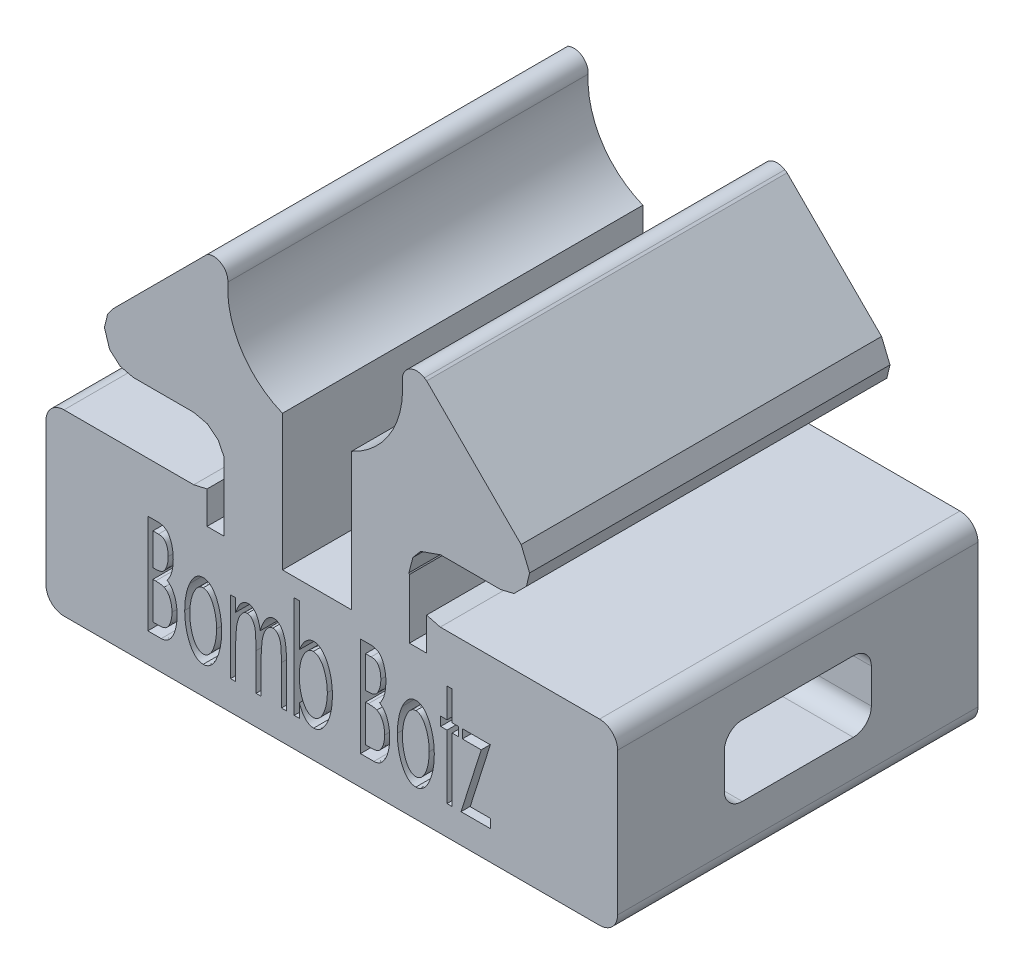
from build123d import *

# Parameters (mm, degrees)
BOSS_EXTRUDE1_DEPTH = 12.7
SKETCH10_R          = 3.082136138
CUT_EXTRUDE1_DEPTH  = 26.185474767
SKETCH11_W          = 2.435876878
SKETCH11_H          = 7.908405343
CUT_EXTRUDE2_DEPTH  = 26.185474767
SKETCH13_W          = 5.182015338
SKETCH13_H          = 2.489456313
CUT_EXTRUDE4_DEPTH  = 31.460304214
FILLET1_R           = 0.635
FILLET2_R           = 0.635
FILLET3_R           = 0.508
CUT_EXTRUDE5_DEPTH  = 1.27
SKETCH17_W          = 0.605016918
SKETCH17_H          = 2.095446093
SKETCH17_W_2        = 0.604461085
SKETCH17_H_2        = 2.141007526
CUT_EXTRUDE7_DEPTH  = 26.185474884


with BuildPart() as part:
    # Sketch5 → Boss-Extrude1 (new body)
    with BuildSketch(Plane.XY):
        Polygon((-6.474794456, -10.4902), (-6.938297275, -10.378313453), (-7.308763147, -10.05450356), (-7.490794456, -9.4742), (-7.378907909, -9.01069718), (-7.193214945, -8.75577951), (-3.863171405, -5.42573597), (-2.833127272, -4.737482484), (-1.618107374, -4.4958), (1.618107374, -4.4958), (2.668236067, -4.674493152), (3.863171405, -5.42573597), (7.193214945, -8.75577951), (7.490794456, -9.4742), (7.378907909, -9.93770282), (6.938297275, -10.378313453), (6.474794456, -10.4902), (4.3434, -10.4902), (3.646537163, -10.737670005), (3.377082754, -11.059343535), (3.2385, -11.5951), (3.485970005, -12.291962837), (3.807643535, -12.561417246), (4.3434, -12.7), (10.5918, -12.7), (10.5918, -18.995576116), (-9.5504, -18.995576116), (-9.5504, -12.7), (-4.3434, -12.7), (-3.863171405, -12.590180165), (-3.485969976, -12.291962837), (-3.271081829, -11.861441531), (-3.271081829, -11.328758469), (-3.485969976, -10.898237163), (-3.863171405, -10.600019835), (-4.3434, -10.4902), align=None)
    extrude(amount=-BOSS_EXTRUDE1_DEPTH)

    # Sketch10 → Cut-Extrude1 (cut, through all)
    with BuildSketch(Plane.XY):
        with Locations((-0.066530556, -6.095976424)):
            Circle(SKETCH10_R)
    extrude(amount=-CUT_EXTRUDE1_DEPTH, mode=Mode.SUBTRACT)

    # Sketch11 → Cut-Extrude2 (cut, through all)
    with BuildSketch(Plane.XY):
        with Locations((0, -9.781904855)):
            Rectangle(SKETCH11_W, SKETCH11_H)
    extrude(amount=-CUT_EXTRUDE2_DEPTH, mode=Mode.SUBTRACT)

    # Sketch13 → Cut-Extrude4 (cut, through all)
    with BuildSketch(Plane.ZY.offset(9.5504)):
        with Locations((-6.35, -15.847788058)):
            Rectangle(SKETCH13_W, SKETCH13_H)
    extrude(amount=-CUT_EXTRUDE4_DEPTH, mode=Mode.SUBTRACT)

    # Fillet1
    fillet1_edges = [part.edges().sort_by_distance(p)[0] for p in [
        (-9.5504, -12.7, -6.35),
    ]]
    fillet(fillet1_edges, radius=FILLET1_R)

    # Fillet2
    fillet2_edges = [part.edges().sort_by_distance(p)[0] for p in [
        (0.5207, -14.603059901, -3.758992331),
        (0.5207, -17.092516214, -3.758992331),
        (0.5207, -17.092516214, -8.941007669),
        (0.5207, -14.603059901, -8.941007669),
        (10.5918, -12.7, -6.35),
        (10.5918, -18.995576116, -6.35),
        (-9.5504, -18.995576116, -6.35),
    ]]
    fillet(fillet2_edges, radius=FILLET2_R)

    # Fillet3
    # the kernel refuses this fillet: 0.508 mm, written as the material it takes off along each edge
    with BuildSketch(Plane(origin=(2.668236067, -4.674493152, 3.28944818), x_dir=(0.8465916632907232, -0.5322429479538895, 0), z_dir=(0, 0, -1))) as fillet3_piece_1:
        with BuildLine():
            CenterArc((1.315779272, 0.508), FILLET3_R, 143.192029884, 126.807970116)
            Line((0.90905007, 0.812360569), (0.900915486, 0.81844778))
            ThreePointArc((0.900915486, 0.81844778), (0.488321858, 0.368360866), (-0.005137978, 0.008765089))
            Line((-0.005137978, 0.008765089), (0, -0.01016))
            Line((0, -0.01016), (1.315779272, -0.01016))
            Line((1.315779272, -0.01016), (1.315779272, 0))
        make_face()
    extrude(amount=19.278896361, mode=Mode.SUBTRACT)
    with BuildSketch(Plane(origin=(-2.833127272, -4.737482484, 3.097058862), x_dir=(-0.8314696122997464, -0.5555702330237908, 0), z_dir=(0, 0, -1))) as fillet3_piece_2:
        with BuildLine():
            CenterArc((1.31839441, -0.501729486), FILLET3_R, 99.011665767, 118.073467257)
            Line((0.913142276, -0.808054001), (0.905037233, -0.814180491))
            ThreePointArc((0.905037233, -0.814180491), (0.490196501, -0.366028623), (-0.005094947, -0.008790172))
            Line((-0.005094947, -0.008790172), (0, 0.01016))
            ThreePointArc((0, 0.01016), (0.619411772, 0.01016), (1.237232128, 0.01003459))
            Line((1.237232128, 0.01003459), (1.238823545, 0))
        make_face()
    extrude(amount=18.894117724, mode=Mode.SUBTRACT)

    # Sketch15 → Cut-Extrude5 (cut)
    # profile 1 of 8: a face of its own
    with BuildSketch(Plane.XY):
        with BuildLine():
            Line((-5.963589534, -14.467780526), (-5.62214322, -14.467780526))
            add(Edge.make_bspline(
                [(-5.62214322, -14.467780526), (-5.589534178, -14.46878798), (-5.527901506, -14.470692118), (-5.441516013, -14.490243243), (-5.365936065, -14.520174515), (-5.302987249, -14.566695465), (-5.249771139, -14.625144193), (-5.202864844, -14.696129356), (-5.163082389, -14.780723785), (-5.128349989, -14.876964552), (-5.101094391, -14.98243947), (-5.080415702, -15.094850671), (-5.068697057, -15.213056959), (-5.067011592, -15.293910926), (-5.066153636, -15.335068186)],
                knots=[0, 0, 0, 0, 1.007703189, 1.904607924, 2.728231251, 3.505327209, 4.303946819, 5.16473243, 6.128960489, 7.190833427, 8.327918668, 9.497182713, 10.725985794, 12, 12, 12, 12], degree=3))
            add(Edge.make_bspline(
                [(-5.066153636, -15.335068186), (-5.06679237, -15.37365502), (-5.068041356, -15.449108083), (-5.078819113, -15.559683483), (-5.09614865, -15.664916555), (-5.120267823, -15.7642439), (-5.151770234, -15.856240685), (-5.1893233, -15.939825865), (-5.233419851, -16.014982543), (-5.269354712, -16.058354109), (-5.287007002, -16.079659533)],
                knots=[0, 0, 0, 0, 1.167664483, 2.283262239, 3.358923896, 4.393422853, 5.373199395, 6.29755825, 7.163709169, 8, 8, 8, 8], degree=3))
            add(Edge.make_bspline(
                [(-5.287007002, -16.079659533), (-5.265820126, -16.095080339), (-5.224295143, -16.125304178), (-5.169500865, -16.178012614), (-5.121183642, -16.233812414), (-5.081674484, -16.295437248), (-5.048107352, -16.361552921), (-5.017327508, -16.432968522), (-4.992028559, -16.511264668), (-4.970278844, -16.595558431), (-4.953059318, -16.684537391), (-4.940091307, -16.777884919), (-4.933516036, -16.874870461), (-4.932203241, -16.940862846), (-4.931538252, -16.974290943)],
                knots=[0, 0, 0, 0, 0.940213205, 1.842760421, 2.724135194, 3.585617653, 4.464149597, 5.385626676, 6.375777621, 7.416178614, 8.510967562, 9.629286614, 10.799127532, 12, 12, 12, 12], degree=3))
            add(Edge.make_bspline(
                [(-4.931538252, -16.974290943), (-4.931796917, -17.008429669), (-4.932304329, -17.075398123), (-4.940567322, -17.17364715), (-4.952378885, -17.267695274), (-4.968054258, -17.358033369), (-4.990305018, -17.444204206), (-5.01563402, -17.526922141), (-5.046920587, -17.605290821), (-5.082042167, -17.678765991), (-5.121005728, -17.746111774), (-5.163309515, -17.805500706), (-5.210257707, -17.854922704), (-5.259417575, -17.896441948), (-5.312482472, -17.928350746), (-5.368830889, -17.950905706), (-5.428325845, -17.965867284), (-5.469440698, -17.967135904), (-5.490332322, -17.967780526)],
                knots=[0, 0, 0, 0, 1.305706815, 2.561348188, 3.769087172, 4.931904447, 6.066077104, 7.171803036, 8.239419409, 9.29119266, 10.284925843, 11.21314407, 12.073370583, 12.886194184, 13.668239408, 14.430351689, 15.202417108, 16, 16, 16, 16], degree=3))
            Line((-5.490332322, -17.967780526), (-5.963589534, -17.967780526))
            Line((-5.963589534, -17.967780526), (-5.963589534, -14.467780526))
        make_face()
        with BuildLine():
            Line((-5.784102354, -14.826754885), (-5.784102354, -15.948549757))
            Line((-5.784102354, -15.948549757), (-5.686646425, -15.948549757))
            add(Edge.make_bspline(
                [(-5.686646425, -15.948549757), (-5.659024836, -15.947836275), (-5.607419502, -15.946503279), (-5.535531687, -15.934491662), (-5.475447719, -15.912718893), (-5.425307923, -15.882594026), (-5.384948483, -15.841407515), (-5.349161734, -15.792451241), (-5.319359759, -15.732824027), (-5.29311326, -15.665473087), (-5.271485576, -15.590896983), (-5.256477584, -15.511302634), (-5.246952842, -15.42761469), (-5.246085687, -15.370618638), (-5.245640816, -15.341378283)],
                knots=[0, 0, 0, 0, 1.158126998, 2.163725294, 3.041371376, 3.824793678, 4.594170469, 5.443102772, 6.359364395, 7.380511659, 8.472453147, 9.610495495, 10.77412628, 12, 12, 12, 12], degree=3))
            add(Edge.make_bspline(
                [(-5.245640816, -15.341378283), (-5.24643037, -15.303463298), (-5.247929231, -15.231486835), (-5.263088834, -15.129866037), (-5.288825731, -15.041027529), (-5.319010095, -14.976200149), (-5.34839721, -14.931644521), (-5.373618308, -14.903711491), (-5.401732116, -14.880006633), (-5.432539782, -14.859931293), (-5.467482314, -14.845732101), (-5.504641724, -14.834052065), (-5.545054209, -14.827941221), (-5.572813815, -14.827157735), (-5.58708713, -14.826754885)],
                knots=[0, 0, 0, 0, 1.952265271, 3.706111235, 5.27563019, 6.702738451, 7.37059395, 8.018508953, 8.633599442, 9.261517843, 9.903363777, 10.569915718, 11.264685426, 12, 12, 12, 12], degree=3))
            Line((-5.58708713, -14.826754885), (-5.784102354, -14.826754885))
        make_face(mode=Mode.SUBTRACT)
        with BuildLine():
            Line((-5.784102354, -16.307524116), (-5.784102354, -17.608806167))
            Line((-5.784102354, -17.608806167), (-5.574466938, -17.608806167))
            add(Edge.make_bspline(
                [(-5.574466938, -17.608806167), (-5.545407451, -17.608279987), (-5.491098027, -17.607296608), (-5.416043649, -17.593031784), (-5.352619022, -17.571529907), (-5.301002884, -17.538212916), (-5.258588115, -17.495091397), (-5.222477059, -17.442073954), (-5.189088856, -17.380049388), (-5.162193525, -17.308103991), (-5.139049701, -17.23018603), (-5.12321637, -17.147500883), (-5.113116047, -17.061948199), (-5.111728433, -17.003767041), (-5.111025431, -16.974290943)],
                knots=[0, 0, 0, 0, 1.164888785, 2.177066614, 3.05569501, 3.836540044, 4.619468312, 5.468124174, 6.404245127, 7.441045181, 8.545645698, 9.66450176, 10.816775421, 12, 12, 12, 12], degree=3))
            add(Edge.make_bspline(
                [(-5.111025431, -16.974290943), (-5.112049658, -16.937796388), (-5.114039567, -16.866893291), (-5.127041238, -16.764109234), (-5.150280649, -16.668661019), (-5.182292887, -16.581426879), (-5.221313133, -16.50341528), (-5.268708874, -16.438209418), (-5.322335588, -16.384438771), (-5.364892372, -16.360625795), (-5.385865175, -16.348890302)],
                knots=[0, 0, 0, 0, 1.222452466, 2.375030106, 3.46297454, 4.505675201, 5.48249602, 6.37345105, 7.198405334, 8, 8, 8, 8], degree=3))
            add(Edge.make_bspline(
                [(-5.385865175, -16.348890302), (-5.402761888, -16.342238106), (-5.44117002, -16.327116914), (-5.509900884, -16.316718034), (-5.5936596, -16.308808196), (-5.654827904, -16.307976055), (-5.688048668, -16.307524116)],
                knots=[0, 0, 0, 0, 0.708155266, 1.609716739, 2.701827025, 4, 4, 4, 4], degree=3))
            Line((-5.688048668, -16.307524116), (-5.784102354, -16.307524116))
        make_face(mode=Mode.SUBTRACT)
    # profile 2 of 8: a face of its own
    with BuildSketch(Plane.XY):
        with BuildLine():
            add(Edge.make_bspline(
                [(-4.010965335, -15.365216424), (-3.987202577, -15.366280698), (-3.939938498, -15.368397537), (-3.871505784, -15.390184301), (-3.806668863, -15.424042529), (-3.744146766, -15.470102283), (-3.686232268, -15.530740461), (-3.631389386, -15.603917735), (-3.579378926, -15.689950096), (-3.549286287, -15.753339913), (-3.533501393, -15.786590622)],
                knots=[0, 0, 0, 0, 0.843577701, 1.677874383, 2.529941952, 3.44009667, 4.428447994, 5.503311921, 6.690378774, 8, 8, 8, 8], degree=3))
            add(Edge.make_bspline(
                [(-3.533501393, -15.786590622), (-3.519491202, -15.819131254), (-3.491125789, -15.885013897), (-3.456655297, -15.988080509), (-3.427184931, -16.095315949), (-3.402160687, -16.206805054), (-3.384970642, -16.323147295), (-3.370077074, -16.443447004), (-3.362863943, -16.568252573), (-3.361644666, -16.65293694), (-3.361025431, -16.69594559)],
                knots=[0, 0, 0, 0, 0.911590579, 1.845630971, 2.79426017, 3.773633235, 4.784390523, 5.820063118, 6.892875455, 8, 8, 8, 8], degree=3))
            add(Edge.make_bspline(
                [(-3.361025431, -16.69594559), (-3.361572897, -16.739192091), (-3.362651139, -16.824366626), (-3.37090819, -16.950086518), (-3.386174601, -17.071620024), (-3.404944066, -17.189345325), (-3.431700919, -17.30258021), (-3.461713559, -17.412049943), (-3.499500821, -17.516938511), (-3.541458488, -17.616603421), (-3.587318855, -17.708603167), (-3.638080994, -17.788948002), (-3.691023083, -17.857925388), (-3.748369165, -17.914123077), (-3.808887337, -17.958344391), (-3.873066612, -17.989976554), (-3.940946523, -18.008956451), (-3.987476748, -18.0114125), (-4.010965335, -18.012652321)],
                knots=[0, 0, 0, 0, 1.301298947, 2.562924903, 3.788461415, 4.986201962, 6.14793309, 7.287790237, 8.39993342, 9.49971249, 10.540722194, 11.488924044, 12.355509222, 13.151197152, 13.89676473, 14.601269901, 15.293917145, 16, 16, 16, 16], degree=3))
            add(Edge.make_bspline(
                [(-4.010965335, -18.012652321), (-4.034447933, -18.011387838), (-4.081191959, -18.008870782), (-4.149369699, -17.990121666), (-4.213761248, -17.958353131), (-4.274315659, -17.913932457), (-4.332295632, -17.857975775), (-4.386002732, -17.789163365), (-4.436693222, -17.708580269), (-4.482509623, -17.616586344), (-4.524808833, -17.517109534), (-4.561115474, -17.411749669), (-4.592928896, -17.302850789), (-4.617764342, -17.189125104), (-4.638446077, -17.071781546), (-4.652069501, -16.950009813), (-4.660775452, -16.824379546), (-4.661791563, -16.739196442), (-4.662307483, -16.69594559)],
                knots=[0, 0, 0, 0, 0.705440217, 1.4042363, 2.108100269, 2.852989273, 3.652997896, 4.523145192, 5.47048404, 6.510546275, 7.609324387, 8.718120464, 9.858867499, 11.017987859, 12.215813406, 13.439407729, 14.699885423, 16, 16, 16, 16], degree=3))
            add(Edge.make_bspline(
                [(-4.662307483, -16.69594559), (-4.661692969, -16.6531693), (-4.660479734, -16.568716052), (-4.653158423, -16.444164378), (-4.638734442, -16.323982861), (-4.620028849, -16.208371479), (-4.596193049, -16.096905412), (-4.566883832, -15.989878754), (-4.532055218, -15.88693716), (-4.503820373, -15.821242279), (-4.489831521, -15.788693988)],
                knots=[0, 0, 0, 0, 1.103600926, 2.178839769, 3.216854868, 4.224898256, 5.199312966, 6.155900535, 7.086347569, 8, 8, 8, 8], degree=3))
            add(Edge.make_bspline(
                [(-4.489831521, -15.788693988), (-4.474076444, -15.755193626), (-4.444121502, -15.691499782), (-4.391770495, -15.605051551), (-4.336662092, -15.531607251), (-4.278278402, -15.47116933), (-4.216700031, -15.423544314), (-4.151036233, -15.390265385), (-4.082220383, -15.368444874), (-4.034729354, -15.366293133), (-4.010965335, -15.365216424)],
                knots=[0, 0, 0, 0, 1.3116991, 2.493918051, 3.576000503, 4.560315464, 5.46508553, 6.321043193, 7.159867415, 8, 8, 8, 8], degree=3))
        make_face()
        with BuildLine():
            add(Edge.make_bspline(
                [(-4.011666457, -15.679318988), (-4.02766861, -15.680288622), (-4.059590517, -15.682222898), (-4.106161569, -15.69726926), (-4.150823162, -15.720629207), (-4.193456831, -15.754082854), (-4.234744119, -15.796042499), (-4.273132084, -15.848242325), (-4.310400991, -15.908977592), (-4.345516199, -15.978164139), (-4.377205156, -16.054295668), (-4.406154237, -16.134615747), (-4.429970545, -16.218969048), (-4.448660164, -16.307367435), (-4.464095488, -16.399508548), (-4.475388436, -16.495655751), (-4.481626503, -16.595600463), (-4.482417154, -16.663451854), (-4.482820303, -16.698048956)],
                knots=[0, 0, 0, 0, 0.633328474, 1.263395849, 1.922297409, 2.622747561, 3.402359392, 4.249154536, 5.185072166, 6.225072861, 7.321168891, 8.452296706, 9.607823688, 10.792618436, 12.032427099, 13.310317054, 14.628543482, 16, 16, 16, 16], degree=3))
            add(Edge.make_bspline(
                [(-4.482820303, -16.698048956), (-4.481983217, -16.742714023), (-4.480332326, -16.830801916), (-4.468144573, -16.960540589), (-4.448678688, -17.08563532), (-4.421710713, -17.204465543), (-4.3881774, -17.314706881), (-4.34752978, -17.412579999), (-4.30313266, -17.498328555), (-4.252018464, -17.569291109), (-4.19696323, -17.626499948), (-4.137844282, -17.667210228), (-4.076062094, -17.694418002), (-4.032961036, -17.697183454), (-4.011666457, -17.698549757)],
                knots=[0, 0, 0, 0, 1.343625255, 2.649881141, 3.916827948, 5.150040387, 6.313170605, 7.378672881, 8.334918638, 9.211145051, 10.001680462, 10.70963726, 11.362481287, 12, 12, 12, 12], degree=3))
            add(Edge.make_bspline(
                [(-4.011666457, -17.698549757), (-3.990369901, -17.697185509), (-3.947264841, -17.694424218), (-3.885514088, -17.667183763), (-3.826395718, -17.62670676), (-3.772009812, -17.569044862), (-3.721018335, -17.498165071), (-3.67549436, -17.412945113), (-3.636082439, -17.31450229), (-3.60244675, -17.204401311), (-3.574436639, -17.085734345), (-3.555251226, -16.960527488), (-3.542984135, -16.830805344), (-3.541344161, -16.742715176), (-3.540512611, -16.698048956)],
                knots=[0, 0, 0, 0, 0.63766136, 1.290651464, 1.99876667, 2.784553339, 3.660975812, 4.620765142, 5.683833951, 6.847224424, 8.082295646, 9.349525938, 10.656074103, 12, 12, 12, 12], degree=3))
            add(Edge.make_bspline(
                [(-3.540512611, -16.698048956), (-3.540917405, -16.663452192), (-3.541711282, -16.595601464), (-3.547926106, -16.495651974), (-3.55930322, -16.399522074), (-3.574447572, -16.3072699), (-3.594205809, -16.219039843), (-3.618090984, -16.134784375), (-3.645763882, -16.053971854), (-3.678714058, -15.978336365), (-3.713642118, -15.909008419), (-3.750767855, -15.847948896), (-3.790082493, -15.796526425), (-3.830551542, -15.753837561), (-3.873247933, -15.720664094), (-3.917863454, -15.697259641), (-3.964221929, -15.68230091), (-3.995901747, -15.680309811), (-4.011666457, -15.679318988)],
                knots=[0, 0, 0, 0, 1.372102031, 2.690948916, 3.969440344, 5.209832555, 6.397176509, 7.553247371, 8.681828641, 9.782077646, 10.822567844, 11.758925988, 12.611729478, 13.385237583, 14.08601742, 14.74522911, 15.375593043, 16, 16, 16, 16], degree=3))
        make_face(mode=Mode.SUBTRACT)
    # profile 3 of 8: a face of its own
    with BuildSketch(Plane.XY):
        with BuildLine():
            Line((-3.046922867, -15.410088218), (-2.867435688, -15.410088218))
            Line((-2.867435688, -15.410088218), (-2.867435688, -15.854599436))
            add(Edge.make_bspline(
                [(-2.867435688, -15.854599436), (-2.853298321, -15.816026088), (-2.826740088, -15.743562812), (-2.780775186, -15.645548815), (-2.736282157, -15.562696143), (-2.701775979, -15.516330211), (-2.685845143, -15.494923956)],
                knots=[0, 0, 0, 0, 1.217816216, 2.287770118, 3.209496512, 4, 4, 4, 4], degree=3))
            add(Edge.make_bspline(
                [(-2.685845143, -15.494923956), (-2.664998425, -15.475175166), (-2.625221796, -15.437493441), (-2.557676535, -15.396119877), (-2.487815224, -15.370462583), (-2.440186597, -15.366953252), (-2.416614374, -15.365216424)],
                knots=[0, 0, 0, 0, 1.120991578, 2.138910614, 3.078914958, 4, 4, 4, 4], degree=3))
            add(Edge.make_bspline(
                [(-2.416614374, -15.365216424), (-2.400879607, -15.366305636), (-2.369102749, -15.368505336), (-2.322137155, -15.382041691), (-2.277283011, -15.406274784), (-2.234089026, -15.438666257), (-2.193240891, -15.478357792), (-2.155697853, -15.524380348), (-2.122645874, -15.576692154), (-2.093725851, -15.636395854), (-2.066439025, -15.705113573), (-2.042541969, -15.785933491), (-2.020118981, -15.87982936), (-2.007546153, -15.94708209), (-2.000849149, -15.982904725)],
                knots=[0, 0, 0, 0, 0.70497467, 1.423718626, 2.167988911, 2.97590154, 3.834418343, 4.712110969, 5.629520406, 6.598314936, 7.678802742, 8.936786955, 10.368358232, 12, 12, 12, 12], degree=3))
            add(Edge.make_bspline(
                [(-2.000849149, -15.982904725), (-1.986622637, -15.935220942), (-1.959649447, -15.844813417), (-1.910077395, -15.719927803), (-1.854952378, -15.613259325), (-1.795069115, -15.524564372), (-1.730352825, -15.454687607), (-1.662801731, -15.403380808), (-1.591245647, -15.37115347), (-1.541907864, -15.367166495), (-1.517776233, -15.365216424)],
                knots=[0, 0, 0, 0, 1.430898735, 2.712956173, 3.858598611, 4.878593333, 5.782223817, 6.584917614, 7.307868261, 8, 8, 8, 8], degree=3))
            add(Edge.make_bspline(
                [(-1.517776233, -15.365216424), (-1.495595535, -15.366905958), (-1.451030067, -15.370300571), (-1.386623503, -15.396215434), (-1.328391395, -15.440397528), (-1.274563957, -15.499365455), (-1.225687699, -15.572616424), (-1.183964629, -15.659643461), (-1.149120369, -15.759682058), (-1.125789975, -15.852102452), (-1.110301936, -15.934776278), (-1.099775105, -16.005380488), (-1.091664958, -16.083540889), (-1.084689649, -16.168867434), (-1.079191541, -16.261673774), (-1.074832686, -16.361940096), (-1.072994567, -16.469709887), (-1.072710421, -16.544035558), (-1.072563893, -16.582363859)],
                knots=[0, 0, 0, 0, 0.756463087, 1.519885966, 2.330984414, 3.234758128, 4.235496569, 5.327959897, 6.52219358, 7.848426635, 8.57957358, 9.394668963, 10.285911105, 11.263066096, 12.318715349, 13.461245202, 14.690813573, 16, 16, 16, 16], degree=3))
            Line((-1.072563893, -16.582363859), (-1.072563893, -17.967780526))
            Line((-1.072563893, -17.967780526), (-1.252051072, -17.967780526))
            Line((-1.252051072, -17.967780526), (-1.252051072, -16.580961616))
            add(Edge.make_bspline(
                [(-1.252051072, -16.580961616), (-1.252221688, -16.548241857), (-1.252549529, -16.485370322), (-1.254022878, -16.395157924), (-1.255813841, -16.312867334), (-1.259435853, -16.238781401), (-1.263638477, -16.172636596), (-1.268195165, -16.114363754), (-1.274515396, -16.064104763), (-1.283538316, -16.008642073), (-1.298324189, -15.94791788), (-1.320043218, -15.881734776), (-1.348470382, -15.82330681), (-1.381642423, -15.773267646), (-1.418605965, -15.731380524), (-1.46045825, -15.701396936), (-1.506402975, -15.682163475), (-1.538626384, -15.680274871), (-1.554935688, -15.679318988)],
                knots=[0, 0, 0, 0, 1.51836297, 2.917558436, 4.186860745, 5.337727298, 6.359248196, 7.262593179, 8.049522409, 8.709208536, 9.869236563, 10.946135496, 11.935605254, 12.874073121, 13.726161472, 14.511594637, 15.246670199, 16, 16, 16, 16], degree=3))
            add(Edge.make_bspline(
                [(-1.554935688, -15.679318988), (-1.57511471, -15.680857345), (-1.616325536, -15.683999072), (-1.674632394, -15.713688311), (-1.729758785, -15.758687159), (-1.780379238, -15.820823021), (-1.82706878, -15.896431793), (-1.866921396, -15.98491855), (-1.899129739, -16.085018487), (-1.921729946, -16.176670849), (-1.934944579, -16.259476006), (-1.945074605, -16.332333932), (-1.952344063, -16.415186802), (-1.958389799, -16.507775482), (-1.964389927, -16.610115024), (-1.967446931, -16.722339295), (-1.969661239, -16.844340431), (-1.969884072, -16.928950433), (-1.96999979, -16.972888699)],
                knots=[0, 0, 0, 0, 0.660002353, 1.34789691, 2.107969646, 2.991979148, 3.96914392, 5.025409628, 6.175424129, 7.424845589, 8.126354717, 8.933170354, 9.844345944, 10.861583212, 11.98578703, 13.216546376, 14.554542928, 16, 16, 16, 16], degree=3))
            Line((-1.96999979, -16.972888699), (-1.96999979, -17.967780526))
            Line((-1.96999979, -17.967780526), (-2.14948697, -17.967780526))
            Line((-2.14948697, -17.967780526), (-2.14948697, -16.667199597))
            add(Edge.make_bspline(
                [(-2.14948697, -16.667199597), (-2.149665377, -16.630507108), (-2.150008566, -16.559924117), (-2.151380899, -16.458724822), (-2.153484187, -16.366638964), (-2.156096035, -16.283885796), (-2.159962342, -16.210443031), (-2.16616121, -16.146257419), (-2.170914772, -16.091157584), (-2.180523372, -16.031210124), (-2.193654481, -15.965652027), (-2.21712588, -15.895350445), (-2.244783453, -15.832815175), (-2.278395663, -15.779519837), (-2.315835523, -15.735148391), (-2.358164556, -15.702706269), (-2.404985971, -15.683025047), (-2.437471787, -15.680557335), (-2.453773829, -15.679318988)],
                knots=[0, 0, 0, 0, 1.574861193, 3.029459675, 4.343833698, 5.52814318, 6.583091089, 7.499410718, 8.295893451, 8.955563666, 10.104512628, 11.160794949, 12.130411979, 13.03206512, 13.856786337, 14.609093303, 15.302014803, 16, 16, 16, 16], degree=3))
            add(Edge.make_bspline(
                [(-2.453773829, -15.679318988), (-2.47299374, -15.68096486), (-2.512689613, -15.684364165), (-2.569417632, -15.713092844), (-2.62327393, -15.757186432), (-2.673810878, -15.817473177), (-2.720397506, -15.891454544), (-2.759659107, -15.978668857), (-2.794453143, -16.076732007), (-2.816488361, -16.167410788), (-2.831046134, -16.247960534), (-2.840852402, -16.317188947), (-2.849028046, -16.39413382), (-2.856229779, -16.478737852), (-2.860553372, -16.57112984), (-2.865232888, -16.670896951), (-2.866994243, -16.778671953), (-2.867284892, -16.852996943), (-2.867435688, -16.891558571)],
                knots=[0, 0, 0, 0, 0.667901347, 1.379451074, 2.174339452, 3.088250632, 4.111091931, 5.216854925, 6.419016473, 7.738532864, 8.468087668, 9.275556869, 10.178113764, 11.168435705, 12.23848396, 13.405914129, 14.654124622, 16, 16, 16, 16], degree=3))
            Line((-2.867435688, -16.891558571), (-2.867435688, -17.967780526))
            Line((-2.867435688, -17.967780526), (-3.046922867, -17.967780526))
            Line((-3.046922867, -17.967780526), (-3.046922867, -15.410088218))
        make_face()
    # profile 4 of 8: a face of its own
    with BuildSketch(Plane.XY):
        with BuildLine():
            Line((-0.803333124, -17.967780526), (-0.803333124, -14.378036936))
            Line((-0.803333124, -14.378036936), (-0.623845944, -14.378036936))
            Line((-0.623845944, -14.378036936), (-0.623845944, -15.874230847))
            add(Edge.make_bspline(
                [(-0.623845944, -15.874230847), (-0.606769209, -15.833944157), (-0.574419832, -15.757626916), (-0.517819166, -15.65383745), (-0.459451289, -15.565212242), (-0.396960821, -15.492513369), (-0.330424144, -15.436086241), (-0.26098279, -15.395058873), (-0.187626362, -15.369434782), (-0.137230441, -15.366622746), (-0.112027034, -15.365216424)],
                knots=[0, 0, 0, 0, 1.371279927, 2.597689275, 3.70130467, 4.693297749, 5.593093873, 6.423879366, 7.211769328, 8, 8, 8, 8], degree=3))
            add(Edge.make_bspline(
                [(-0.112027034, -15.365216424), (-0.089695821, -15.366452655), (-0.045216851, -15.368914961), (0.019855829, -15.388284612), (0.082232159, -15.41903263), (0.142460688, -15.461483986), (0.198542247, -15.517523417), (0.252551202, -15.584677097), (0.304572061, -15.663703206), (0.352608216, -15.754131847), (0.3969118, -15.852805107), (0.436560038, -15.957555008), (0.468981155, -16.06785577), (0.496887254, -16.182832765), (0.516432791, -16.303418262), (0.532216053, -16.428709139), (0.541416134, -16.559555882), (0.542346343, -16.64848897), (0.542820723, -16.693842225)],
                knots=[0, 0, 0, 0, 0.666834484, 1.328190814, 2.012624616, 2.739681146, 3.52046551, 4.375006532, 5.313068699, 6.344837697, 7.433265496, 8.545590816, 9.690816455, 10.868811167, 12.080825012, 13.341092928, 14.64403571, 16, 16, 16, 16], degree=3))
            add(Edge.make_bspline(
                [(0.542820723, -16.693842225), (0.542347641, -16.738495444), (0.54141778, -16.826263153), (0.532152526, -16.955461669), (0.516635571, -17.079674044), (0.495929129, -17.199157336), (0.468508823, -17.313354739), (0.435505106, -17.422771353), (0.396513313, -17.527164033), (0.351227078, -17.625203427), (0.302193703, -17.714818996), (0.250482356, -17.794073426), (0.196009944, -17.861174839), (0.138526126, -17.916072263), (0.078856427, -17.959815244), (0.015699071, -17.990441119), (-0.050020484, -18.008690721), (-0.09462314, -18.011331377), (-0.116934886, -18.012652321)],
                knots=[0, 0, 0, 0, 1.340122652, 2.634065311, 3.885240942, 5.096185043, 6.271872362, 7.408055191, 8.524644743, 9.613771782, 10.64668928, 11.58834762, 12.450598855, 13.234564774, 13.968476263, 14.661843387, 15.330609126, 16, 16, 16, 16], degree=3))
            add(Edge.make_bspline(
                [(-0.116934886, -18.012652321), (-0.142340535, -18.011152077), (-0.193280849, -18.008143971), (-0.267609298, -17.983968904), (-0.337067568, -17.943303631), (-0.403675261, -17.888138654), (-0.465373587, -17.815281046), (-0.522732621, -17.724527441), (-0.577337372, -17.616560169), (-0.607779294, -17.536681637), (-0.623845944, -17.494523315)],
                knots=[0, 0, 0, 0, 0.787562838, 1.579125175, 2.397976651, 3.273906639, 4.251222186, 5.347932763, 6.600290935, 8, 8, 8, 8], degree=3))
            Line((-0.623845944, -17.494523315), (-0.623845944, -17.967780526))
            Line((-0.623845944, -17.967780526), (-0.803333124, -17.967780526))
        make_face()
        with BuildLine():
            add(Edge.make_bspline(
                [(-0.130957322, -17.698549757), (-0.108762514, -17.696868232), (-0.063950567, -17.693473185), (0.001011679, -17.667008405), (0.062002828, -17.624293263), (0.119198714, -17.565700803), (0.173305693, -17.493427667), (0.220251736, -17.40628201), (0.262387997, -17.306733517), (0.297942132, -17.195640488), (0.327182508, -17.076177236), (0.347845939, -16.951717085), (0.361032288, -16.823833855), (0.36255928, -16.737578221), (0.363333543, -16.693842225)],
                knots=[0, 0, 0, 0, 0.657786529, 1.328089627, 2.052027622, 2.856990137, 3.749654712, 4.725235723, 5.788901291, 6.956707324, 8.185706879, 9.438700918, 10.701291008, 12, 12, 12, 12], degree=3))
            add(Edge.make_bspline(
                [(0.363333543, -16.693842225), (0.362515262, -16.6501124), (0.360892754, -16.563403749), (0.348237752, -16.434931056), (0.326053949, -16.309764089), (0.297347519, -16.18922513), (0.261550625, -16.076829562), (0.219912862, -15.975740199), (0.171602379, -15.888043707), (0.117775618, -15.814445845), (0.061084807, -15.754171379), (-0.00030003, -15.712198563), (-0.06348854, -15.684265966), (-0.107322823, -15.680948505), (-0.128853957, -15.679318988)],
                knots=[0, 0, 0, 0, 1.292893791, 2.563583935, 3.812134528, 5.049061508, 6.224790131, 7.296423726, 8.277031188, 9.176806139, 9.98799582, 10.708692254, 11.36571745, 12, 12, 12, 12], degree=3))
            add(Edge.make_bspline(
                [(-0.128853957, -15.679318988), (-0.150605532, -15.680974913), (-0.195082482, -15.684360897), (-0.259501399, -15.712090207), (-0.322370505, -15.754448971), (-0.3815601, -15.81397911), (-0.437406001, -15.886280144), (-0.485490032, -15.972034449), (-0.528642743, -16.06819276), (-0.562838674, -16.176082429), (-0.58981971, -16.292663356), (-0.609366557, -16.41683763), (-0.621416857, -16.548004666), (-0.623023281, -16.637959754), (-0.623845944, -16.68402652)],
                knots=[0, 0, 0, 0, 0.642827838, 1.314434586, 2.048503311, 2.881431429, 3.790527276, 4.749602412, 5.788656785, 6.910486039, 8.098690173, 9.333453703, 10.634438985, 12, 12, 12, 12], degree=3))
            add(Edge.make_bspline(
                [(-0.623845944, -16.68402652), (-0.62352508, -16.719329959), (-0.62289543, -16.788607872), (-0.615501691, -16.890359778), (-0.604560639, -16.987720209), (-0.589042526, -17.080612576), (-0.569709236, -17.169240555), (-0.545067439, -17.253231984), (-0.516458906, -17.333046413), (-0.483002563, -17.407130058), (-0.447173655, -17.474919904), (-0.408587151, -17.534146224), (-0.368069911, -17.584914255), (-0.324169197, -17.625219121), (-0.279967439, -17.65913394), (-0.231970841, -17.681258289), (-0.182379319, -17.696567976), (-0.148132775, -17.697887822), (-0.130957322, -17.698549757)],
                knots=[0, 0, 0, 0, 1.383204787, 2.714340084, 3.995776056, 5.221372194, 6.403491579, 7.548302738, 8.649227815, 9.723273024, 10.731247881, 11.650798515, 12.490437703, 13.267992902, 13.982413771, 14.662427744, 15.329175827, 16, 16, 16, 16], degree=3))
        make_face(mode=Mode.SUBTRACT)
    # profile 5 of 8: a face of its own
    with BuildSketch(Plane.XY):
        with BuildLine():
            Line((1.53000021, -14.467780526), (1.871446524, -14.467780526))
            add(Edge.make_bspline(
                [(1.871446524, -14.467780526), (1.904055566, -14.46878798), (1.965688237, -14.470692118), (2.05207373, -14.490243243), (2.127653679, -14.520174515), (2.190602495, -14.566695465), (2.243818604, -14.625144193), (2.290724899, -14.696129356), (2.330507355, -14.780723785), (2.365239755, -14.876964552), (2.392495352, -14.98243947), (2.413174042, -15.094850671), (2.424892687, -15.213056959), (2.426578152, -15.293910926), (2.427436107, -15.335068186)],
                knots=[0, 0, 0, 0, 1.007703189, 1.904607924, 2.728231251, 3.505327209, 4.303946819, 5.16473243, 6.128960489, 7.190833427, 8.327918668, 9.497182713, 10.725985794, 12, 12, 12, 12], degree=3))
            add(Edge.make_bspline(
                [(2.427436107, -15.335068186), (2.426797374, -15.37365502), (2.425548388, -15.449108083), (2.41477063, -15.559683483), (2.397441093, -15.664916555), (2.373321921, -15.7642439), (2.34181951, -15.856240685), (2.304266443, -15.939825865), (2.260169893, -16.014982543), (2.224235032, -16.058354109), (2.206582742, -16.079659533)],
                knots=[0, 0, 0, 0, 1.167664483, 2.283262239, 3.358923896, 4.393422853, 5.373199395, 6.29755825, 7.163709169, 8, 8, 8, 8], degree=3))
            add(Edge.make_bspline(
                [(2.206582742, -16.079659533), (2.227769618, -16.095080339), (2.2692946, -16.125304178), (2.324088879, -16.178012614), (2.372406102, -16.233812414), (2.411915259, -16.295437248), (2.445482392, -16.361552921), (2.476262236, -16.432968522), (2.501561184, -16.511264668), (2.5233109, -16.595558431), (2.540530426, -16.684537391), (2.553498437, -16.777884919), (2.560073708, -16.874870461), (2.561386503, -16.940862846), (2.562051492, -16.974290943)],
                knots=[0, 0, 0, 0, 0.940213205, 1.842760421, 2.724135194, 3.585617653, 4.464149597, 5.385626676, 6.375777621, 7.416178614, 8.510967562, 9.629286614, 10.799127532, 12, 12, 12, 12], degree=3))
            add(Edge.make_bspline(
                [(2.562051492, -16.974290943), (2.561792827, -17.008429669), (2.561285415, -17.075398123), (2.553022422, -17.17364715), (2.541210859, -17.267695274), (2.525535486, -17.358033369), (2.503284726, -17.444204206), (2.477955724, -17.526922141), (2.446669157, -17.605290821), (2.411547577, -17.678765991), (2.372584016, -17.746111774), (2.330280229, -17.805500706), (2.283332037, -17.854922704), (2.234172168, -17.896441948), (2.181107271, -17.928350746), (2.124758855, -17.950905706), (2.065263898, -17.965867284), (2.024149046, -17.967135904), (2.003257421, -17.967780526)],
                knots=[0, 0, 0, 0, 1.305706815, 2.561348188, 3.769087172, 4.931904447, 6.066077104, 7.171803036, 8.239419409, 9.29119266, 10.284925843, 11.21314407, 12.073370583, 12.886194184, 13.668239408, 14.430351689, 15.202417108, 16, 16, 16, 16], degree=3))
            Line((2.003257421, -17.967780526), (1.53000021, -17.967780526))
            Line((1.53000021, -17.967780526), (1.53000021, -14.467780526))
        make_face()
        with BuildLine():
            Line((1.709487389, -14.826754885), (1.709487389, -15.948549757))
            Line((1.709487389, -15.948549757), (1.806943319, -15.948549757))
            add(Edge.make_bspline(
                [(1.806943319, -15.948549757), (1.834564907, -15.947836275), (1.886170241, -15.946503279), (1.958058057, -15.934491662), (2.018142024, -15.912718893), (2.068281821, -15.882594026), (2.108641261, -15.841407515), (2.144428009, -15.792451241), (2.174229984, -15.732824027), (2.200476483, -15.665473087), (2.222104168, -15.590896983), (2.237112159, -15.511302634), (2.246636902, -15.42761469), (2.247504056, -15.370618638), (2.247948928, -15.341378283)],
                knots=[0, 0, 0, 0, 1.158126998, 2.163725294, 3.041371376, 3.824793678, 4.594170469, 5.443102772, 6.359364395, 7.380511659, 8.472453147, 9.610495495, 10.77412628, 12, 12, 12, 12], degree=3))
            add(Edge.make_bspline(
                [(2.247948928, -15.341378283), (2.247159374, -15.303463298), (2.245660512, -15.231486835), (2.23050091, -15.129866037), (2.204764012, -15.041027529), (2.174579648, -14.976200149), (2.145192533, -14.931644521), (2.119971435, -14.903711491), (2.091857628, -14.880006633), (2.061049962, -14.859931293), (2.02610743, -14.845732101), (1.988948019, -14.834052065), (1.948535535, -14.827941221), (1.920775928, -14.827157735), (1.906502614, -14.826754885)],
                knots=[0, 0, 0, 0, 1.952265271, 3.706111235, 5.27563019, 6.702738451, 7.37059395, 8.018508953, 8.633599442, 9.261517843, 9.903363777, 10.569915718, 11.264685426, 12, 12, 12, 12], degree=3))
            Line((1.906502614, -14.826754885), (1.709487389, -14.826754885))
        make_face(mode=Mode.SUBTRACT)
        with BuildLine():
            Line((1.709487389, -16.307524116), (1.709487389, -17.608806167))
            Line((1.709487389, -17.608806167), (1.919122806, -17.608806167))
            add(Edge.make_bspline(
                [(1.919122806, -17.608806167), (1.948182293, -17.608279987), (2.002491716, -17.607296608), (2.077546094, -17.593031784), (2.140970722, -17.571529907), (2.19258686, -17.538212916), (2.235001628, -17.495091397), (2.271112685, -17.442073954), (2.304500887, -17.380049388), (2.331396219, -17.308103991), (2.354540043, -17.23018603), (2.370373373, -17.147500883), (2.380473697, -17.061948199), (2.381861311, -17.003767041), (2.382564312, -16.974290943)],
                knots=[0, 0, 0, 0, 1.164888785, 2.177066614, 3.05569501, 3.836540044, 4.619468312, 5.468124174, 6.404245127, 7.441045181, 8.545645698, 9.66450176, 10.816775421, 12, 12, 12, 12], degree=3))
            add(Edge.make_bspline(
                [(2.382564312, -16.974290943), (2.381540086, -16.937796388), (2.379550177, -16.866893291), (2.366548506, -16.764109234), (2.343309094, -16.668661019), (2.311296857, -16.581426879), (2.272276611, -16.50341528), (2.224880869, -16.438209418), (2.171254156, -16.384438771), (2.128697372, -16.360625795), (2.107724569, -16.348890302)],
                knots=[0, 0, 0, 0, 1.222452466, 2.375030106, 3.46297454, 4.505675201, 5.48249602, 6.37345105, 7.198405334, 8, 8, 8, 8], degree=3))
            add(Edge.make_bspline(
                [(2.107724569, -16.348890302), (2.090827856, -16.342238106), (2.052419723, -16.327116914), (1.983688859, -16.316718034), (1.899930143, -16.308808196), (1.83876184, -16.307976055), (1.805541075, -16.307524116)],
                knots=[0, 0, 0, 0, 0.708155266, 1.609716739, 2.701827025, 4, 4, 4, 4], degree=3))
            Line((1.805541075, -16.307524116), (1.709487389, -16.307524116))
        make_face(mode=Mode.SUBTRACT)
    # profile 6 of 8: a face of its own
    with BuildSketch(Plane.XY):
        with BuildLine():
            add(Edge.make_bspline(
                [(3.482624408, -15.365216424), (3.506387166, -15.366280698), (3.553651245, -15.368397537), (3.62208396, -15.390184301), (3.686920881, -15.424042529), (3.749442978, -15.470102283), (3.807357475, -15.530740461), (3.862200358, -15.603917735), (3.914210818, -15.689950096), (3.944303456, -15.753339913), (3.960088351, -15.786590622)],
                knots=[0, 0, 0, 0, 0.843577701, 1.677874383, 2.529941952, 3.44009667, 4.428447994, 5.503311921, 6.690378774, 8, 8, 8, 8], degree=3))
            add(Edge.make_bspline(
                [(3.960088351, -15.786590622), (3.974098542, -15.819131254), (4.002463954, -15.885013897), (4.036934447, -15.988080509), (4.066404813, -16.095315949), (4.091429056, -16.206805054), (4.108619101, -16.323147295), (4.123512669, -16.443447004), (4.1307258, -16.568252573), (4.131945078, -16.65293694), (4.132564312, -16.69594559)],
                knots=[0, 0, 0, 0, 0.911590579, 1.845630971, 2.79426017, 3.773633235, 4.784390523, 5.820063118, 6.892875455, 8, 8, 8, 8], degree=3))
            add(Edge.make_bspline(
                [(4.132564312, -16.69594559), (4.132016846, -16.739192091), (4.130938605, -16.824366626), (4.122681554, -16.950086518), (4.107415142, -17.071620024), (4.088645678, -17.189345325), (4.061888825, -17.30258021), (4.031876185, -17.412049943), (3.994088922, -17.516938511), (3.952131256, -17.616603421), (3.906270888, -17.708603167), (3.85550875, -17.788948002), (3.802566661, -17.857925388), (3.745220579, -17.914123077), (3.684702407, -17.958344391), (3.620523131, -17.989976554), (3.552643221, -18.008956451), (3.506112996, -18.0114125), (3.482624408, -18.012652321)],
                knots=[0, 0, 0, 0, 1.301298947, 2.562924903, 3.788461415, 4.986201962, 6.14793309, 7.287790237, 8.39993342, 9.49971249, 10.540722194, 11.488924044, 12.355509222, 13.151197152, 13.89676473, 14.601269901, 15.293917145, 16, 16, 16, 16], degree=3))
            add(Edge.make_bspline(
                [(3.482624408, -18.012652321), (3.459141811, -18.011387838), (3.412397784, -18.008870782), (3.344220045, -17.990121666), (3.279828495, -17.958353131), (3.219274085, -17.913932457), (3.161294112, -17.857975775), (3.107587011, -17.789163365), (3.056896522, -17.708580269), (3.01108012, -17.616586344), (2.96878091, -17.517109534), (2.932474269, -17.411749669), (2.900660848, -17.302850789), (2.875825401, -17.189125104), (2.855143666, -17.071781546), (2.841520243, -16.950009813), (2.832814291, -16.824379546), (2.831798181, -16.739196442), (2.831282261, -16.69594559)],
                knots=[0, 0, 0, 0, 0.705440217, 1.4042363, 2.108100269, 2.852989273, 3.652997896, 4.523145192, 5.47048404, 6.510546275, 7.609324387, 8.718120464, 9.858867499, 11.017987859, 12.215813406, 13.439407729, 14.699885423, 16, 16, 16, 16], degree=3))
            add(Edge.make_bspline(
                [(2.831282261, -16.69594559), (2.831896775, -16.6531693), (2.833110009, -16.568716052), (2.840431321, -16.444164378), (2.854855302, -16.323982861), (2.873560895, -16.208371479), (2.897396695, -16.096905412), (2.926705912, -15.989878754), (2.961534525, -15.88693716), (2.98976937, -15.821242279), (3.003758223, -15.788693988)],
                knots=[0, 0, 0, 0, 1.103600926, 2.178839769, 3.216854868, 4.224898256, 5.199312966, 6.155900535, 7.086347569, 8, 8, 8, 8], degree=3))
            add(Edge.make_bspline(
                [(3.003758223, -15.788693988), (3.019513299, -15.755193626), (3.049468242, -15.691499782), (3.101819249, -15.605051551), (3.156927651, -15.531607251), (3.215311342, -15.47116933), (3.276889713, -15.423544314), (3.342553511, -15.390265385), (3.41136936, -15.368444874), (3.45886039, -15.366293133), (3.482624408, -15.365216424)],
                knots=[0, 0, 0, 0, 1.3116991, 2.493918051, 3.576000503, 4.560315464, 5.46508553, 6.321043193, 7.159867415, 8, 8, 8, 8], degree=3))
        make_face()
        with BuildLine():
            add(Edge.make_bspline(
                [(3.481923287, -15.679318988), (3.465921134, -15.680288622), (3.433999226, -15.682222898), (3.387428175, -15.69726926), (3.342766582, -15.720629207), (3.300132913, -15.754082854), (3.258845624, -15.796042499), (3.220457659, -15.848242325), (3.183188753, -15.908977592), (3.148073544, -15.978164139), (3.116384587, -16.054295668), (3.087435506, -16.134615747), (3.063619199, -16.218969048), (3.04492958, -16.307367435), (3.029494256, -16.399508548), (3.018201307, -16.495655751), (3.01196324, -16.595600463), (3.01117259, -16.663451854), (3.01076944, -16.698048956)],
                knots=[0, 0, 0, 0, 0.633328474, 1.263395849, 1.922297409, 2.622747561, 3.402359392, 4.249154536, 5.185072166, 6.225072861, 7.321168891, 8.452296706, 9.607823688, 10.792618436, 12.032427099, 13.310317054, 14.628543482, 16, 16, 16, 16], degree=3))
            add(Edge.make_bspline(
                [(3.01076944, -16.698048956), (3.011606526, -16.742714023), (3.013257417, -16.830801916), (3.025445171, -16.960540589), (3.044911056, -17.08563532), (3.071879031, -17.204465543), (3.105412344, -17.314706881), (3.146059963, -17.412579999), (3.190457083, -17.498328555), (3.24157128, -17.569291109), (3.296626514, -17.626499948), (3.355745461, -17.667210228), (3.41752765, -17.694418002), (3.460628708, -17.697183454), (3.481923287, -17.698549757)],
                knots=[0, 0, 0, 0, 1.343625255, 2.649881141, 3.916827948, 5.150040387, 6.313170605, 7.378672881, 8.334918638, 9.211145051, 10.001680462, 10.70963726, 11.362481287, 12, 12, 12, 12], degree=3))
            add(Edge.make_bspline(
                [(3.481923287, -17.698549757), (3.503219843, -17.697185509), (3.546324903, -17.694424218), (3.608075656, -17.667183763), (3.667194026, -17.62670676), (3.721579932, -17.569044862), (3.772571408, -17.498165071), (3.818095383, -17.412945113), (3.857507305, -17.31450229), (3.891142993, -17.204401311), (3.919153105, -17.085734345), (3.938338518, -16.960527488), (3.950605609, -16.830805344), (3.952245582, -16.742715176), (3.953077133, -16.698048956)],
                knots=[0, 0, 0, 0, 0.63766136, 1.290651464, 1.99876667, 2.784553339, 3.660975812, 4.620765142, 5.683833951, 6.847224424, 8.082295646, 9.349525938, 10.656074103, 12, 12, 12, 12], degree=3))
            add(Edge.make_bspline(
                [(3.953077133, -16.698048956), (3.952672339, -16.663452192), (3.951878461, -16.595601464), (3.945663638, -16.495651974), (3.934286523, -16.399522074), (3.919142171, -16.3072699), (3.899383934, -16.219039843), (3.875498759, -16.134784375), (3.847825862, -16.053971854), (3.814875685, -15.978336365), (3.779947626, -15.909008419), (3.742821889, -15.847948896), (3.70350725, -15.796526425), (3.663038202, -15.753837561), (3.62034181, -15.720664094), (3.57572629, -15.697259641), (3.529367814, -15.68230091), (3.497687996, -15.680309811), (3.481923287, -15.679318988)],
                knots=[0, 0, 0, 0, 1.372102031, 2.690948916, 3.969440344, 5.209832555, 6.397176509, 7.553247371, 8.681828641, 9.782077646, 10.822567844, 11.758925988, 12.611729478, 13.385237583, 14.08601742, 14.74522911, 15.375593043, 16, 16, 16, 16], degree=3))
        make_face(mode=Mode.SUBTRACT)
    # profile 7 of 8: a face of its own
    with BuildSketch(Plane.XY):
        Polygon((4.581282261, -14.378036936), (4.76076944, -14.378036936), (4.76076944, -15.410088218), (4.985128415, -15.410088218), (4.985128415, -15.724190783), (4.76076944, -15.724190783), (4.76076944, -17.967780526), (4.581282261, -17.967780526), (4.581282261, -15.724190783), (4.356923287, -15.724190783), (4.356923287, -15.410088218), (4.581282261, -15.410088218), align=None)
    # profile 8 of 8: a face of its own
    with BuildSketch(Plane.XY):
        Polygon((5.119743799, -15.410088218), (6.106923287, -15.410088218), (5.395985787, -17.653677962), (6.106923287, -17.653677962), (6.106923287, -17.967780526), (5.074872005, -17.967780526), (5.786510626, -15.724190783), (5.119743799, -15.724190783), align=None)
    extrude(amount=-CUT_EXTRUDE5_DEPTH, mode=Mode.SUBTRACT)

    # Sketch17 → Cut-Extrude7 (cut, through all)
    with BuildSketch(Plane.XY):
        with Locations((3.55718824, -12.68838448)):
            Rectangle(SKETCH17_W, SKETCH17_H)
        with Locations((-3.573312372, -12.665603763)):
            Rectangle(SKETCH17_W_2, SKETCH17_H_2)
    extrude(amount=-CUT_EXTRUDE7_DEPTH, mode=Mode.SUBTRACT)


solid = part.part
